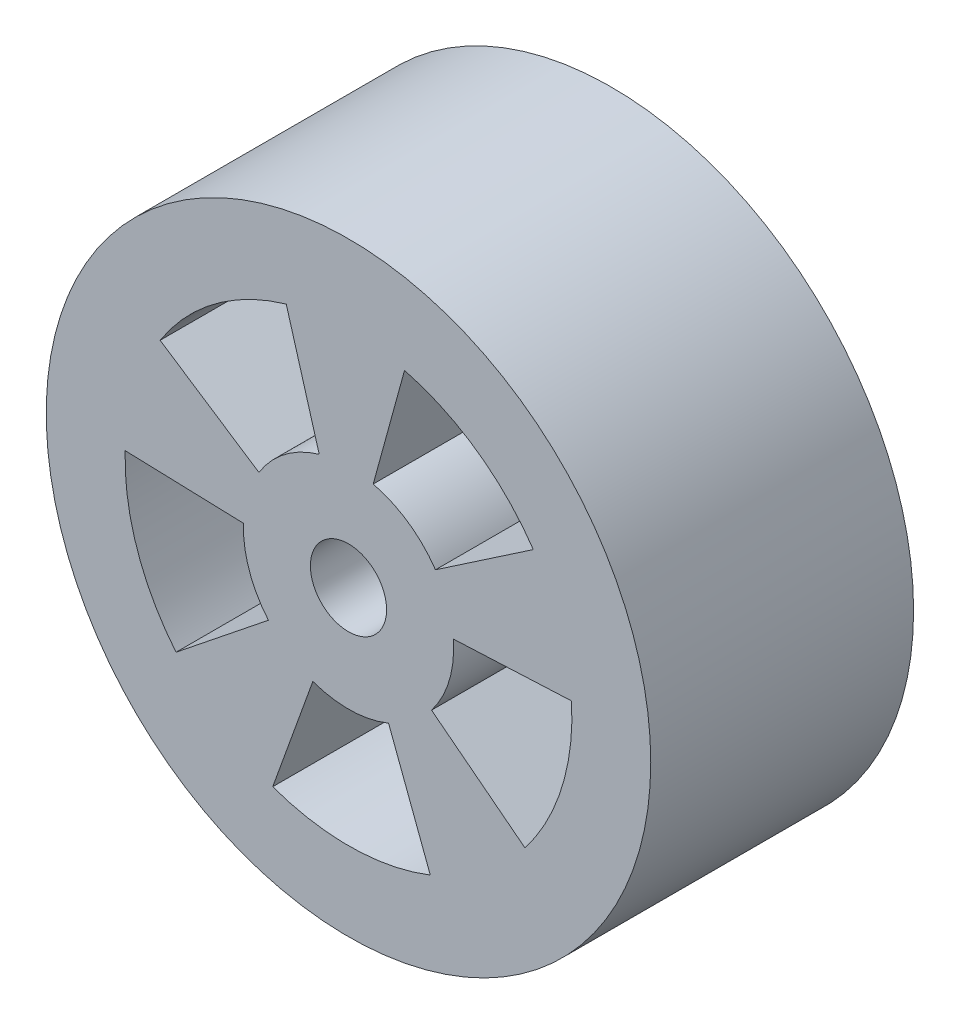
from build123d import *

# Parameters (mm, degrees)
SKETCH1_R           = 11.5
BOSS_EXTRUDE1_DEPTH = 10
SKETCH2_R           = 8.5
CUT_EXTRUDE2_DEPTH  = 10
SKETCH4_R           = 4
BOSS_EXTRUDE2_DEPTH = 10
BOSS_EXTRUDE3_START = 10
BOSS_EXTRUDE3_DEPTH = 10
CIRPATTERN1_COUNT   = 5
SKETCH7_R           = 1.45
CUT_EXTRUDE3_DEPTH  = 10
SKETCH8_R           = 1.75
BOSS_EXTRUDE4_DEPTH = 2
CUT_EXTRUDE4_START  = -2
SKETCH9_R           = 1.45
CUT_EXTRUDE4_DEPTH  = 2
FILLET1_R           = 2.25


with BuildPart() as part:
    # Sketch1 → Boss-Extrude1 (new body)
    with BuildSketch(Plane.XY):
        Circle(SKETCH1_R)
    extrude(amount=BOSS_EXTRUDE1_DEPTH)

    # Sketch2 → Cut-Extrude2 (cut)
    with BuildSketch(Plane.XY.offset(10)):
        Circle(SKETCH2_R)
    extrude(amount=-CUT_EXTRUDE2_DEPTH, mode=Mode.SUBTRACT)



with BuildPart() as body_2:
    # Sketch4 → Boss-Extrude2 (new body)
    with BuildSketch(Plane.XY):
        Circle(SKETCH4_R)
    extrude(amount=BOSS_EXTRUDE2_DEPTH)


with BuildPart() as part_1:
    add(part.part)

    add(body_2.part)  # Boss-Extrude3 merges body 2
    # Sketch6 → Boss-Extrude3 (add)
    with BuildSketch(Plane.XY.offset(BOSS_EXTRUDE3_START)):
        with BuildLine():
            Line((-1.114437127, 3.841618134), (-2.368178894, 8.163438536))
            ThreePointArc((-2.368178894, 8.163438536), (-0.122551325, 8.499116494), (2.131821106, 8.228325393))
            Line((2.131821106, 8.228325393), (0.940332104, 3.887901173))
            ThreePointArc((0.940332104, 3.887901173), (-0.090075911, 3.998985663), (-1.114437127, 3.841618134))
        make_face()
    boss_extrude3 = extrude(amount=-BOSS_EXTRUDE3_DEPTH)

    # CirPattern1: Boss-Extrude3 ×5 about axis
    cirpattern1_axis = Axis((0, 0, 0), (0, 0, 1))
    for i in range(1, CIRPATTERN1_COUNT):
        add(boss_extrude3.rotate(cirpattern1_axis, i * 360 / CIRPATTERN1_COUNT))

    # Sketch7 → Cut-Extrude3 (cut)
    with BuildSketch(Plane.XY.offset(10)):
        Circle(SKETCH7_R)
    extrude(amount=-CUT_EXTRUDE3_DEPTH, mode=Mode.SUBTRACT)

    # Sketch8 → Boss-Extrude4 (add)
    with BuildSketch(Plane(origin=(0, 0, 0), x_dir=(-1, 0, 0), z_dir=(0, 0, -1))):
        with Locations(Location((0, 0, 0), (0, 0, 180))):
            Circle(SKETCH8_R)
    extrude(amount=BOSS_EXTRUDE4_DEPTH)

    # Sketch9 → Cut-Extrude4 (cut)
    with BuildSketch(Plane(origin=(0, 0, -2), x_dir=(-1, 0, 0), z_dir=(0, 0, -1)).offset(CUT_EXTRUDE4_START)):
        with Locations(Location((0, 0, 0), (0, 0, 180))):
            Circle(SKETCH9_R)
    extrude(amount=CUT_EXTRUDE4_DEPTH, mode=Mode.SUBTRACT)

    # Fillet1
    # the kernel refuses this fillet: 2.25 mm, written as the material it adds along each edge
    with BuildSketch(Plane(origin=(0, 0, 0), x_dir=(1, 0, 0), z_dir=(0, 1, 0))) as fillet1_piece_1:
        with BuildLine():
            CenterArc((3.986067977, 2.25), FILLET1_R, 186.379370208, 83.620629792)
            Line((1.75, 2), (1.70527864, 1.995))
            ThreePointArc((1.70527864, 1.995), (1.705, 1), (1.705, 0))
            Line((1.705, 0), (1.75, -0.045))
            Line((1.75, -0.045), (3.986067977, -0.045))
            Line((3.986067977, -0.045), (3.986067977, 0))
        make_face()
    revolve(axis=Axis((0, 0, 0), (0, 0, -1)))


solid = part_1.part
